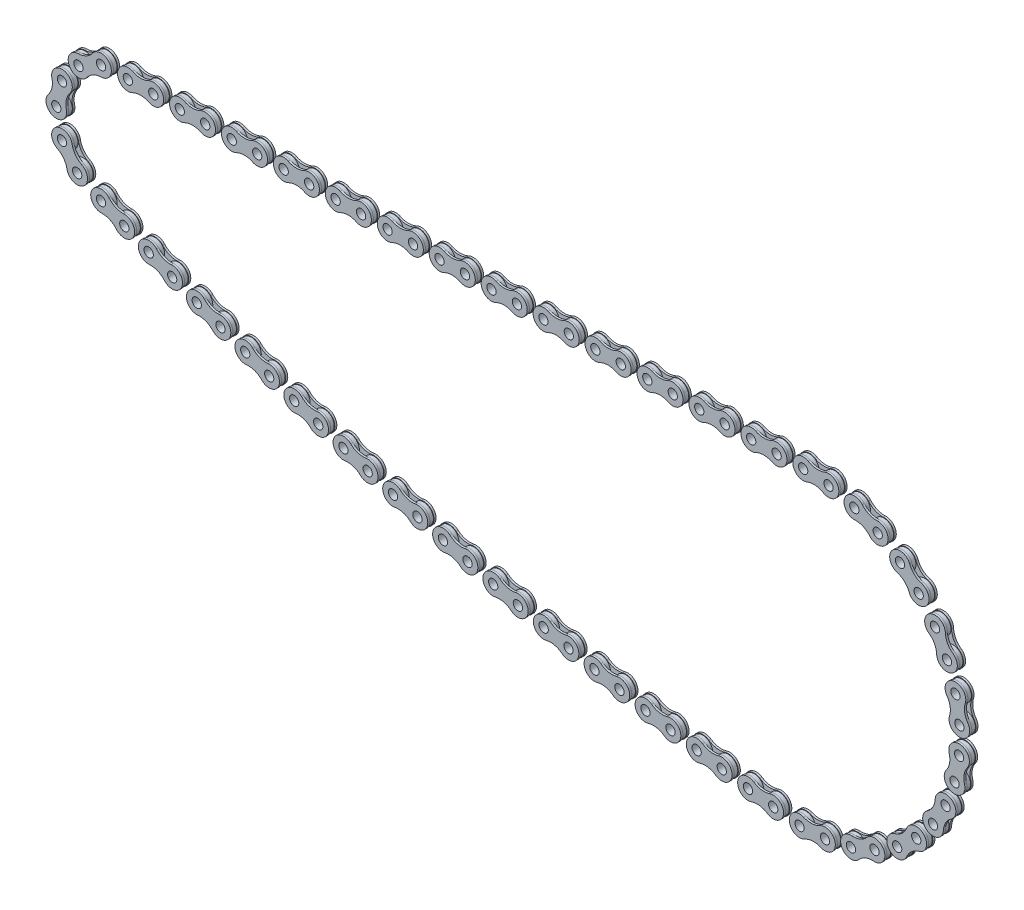
from build123d import *

# Parameters (mm, degrees)
SKETCH1_R             = 4.75
SKETCH1_R_2           = 2.25
BOSS_EXTRUDE1_DEPTH   = 1
BOSS_EXTRUDE1_2_DEPTH = 1
SKETCH2_R             = 2.25
BOSS_EXTRUDE5_DEPTH   = 1
CRVPATTERN3_5_ANGLE   = 4.2897485
CRVPATTERN3_6_ANGLE   = 23.4823476
CRVPATTERN3_7_ANGLE   = 42.6749468
CRVPATTERN3_8_ANGLE   = 61.8675459
CRVPATTERN3_9_ANGLE   = 81.0601451
CRVPATTERN3_10_ANGLE  = 100.2527442
CRVPATTERN3_11_ANGLE  = 119.4453434
CRVPATTERN3_12_ANGLE  = 138.6379425
CRVPATTERN3_13_ANGLE  = 157.8305417
CRVPATTERN3_14_ANGLE  = 177.0231408
CRVPATTERN3_15_ANGLE  = 172.4039679
CRVPATTERN3_16_ANGLE  = 171.1581482
CRVPATTERN3_17_ANGLE  = 169.9123286
CRVPATTERN3_18_ANGLE  = 168.6665089
CRVPATTERN3_19_ANGLE  = 167.4206893
CRVPATTERN3_20_ANGLE  = 166.1748696
CRVPATTERN3_21_ANGLE  = 164.92905
CRVPATTERN3_22_ANGLE  = 163.6832303
CRVPATTERN3_23_ANGLE  = 162.4374107
CRVPATTERN3_24_ANGLE  = 161.191591
CRVPATTERN3_25_ANGLE  = 159.9457714
CRVPATTERN3_26_ANGLE  = 158.6999517
CRVPATTERN3_27_ANGLE  = 157.4541321
CRVPATTERN3_28_ANGLE  = 156.2083125
CRVPATTERN3_29_ANGLE  = 126.7026711
CRVPATTERN3_30_ANGLE  = 77.2372093
CRVPATTERN3_31_ANGLE  = 27.7717476


with BuildPart() as part:
    # Sketch1 → Boss-Extrude1 (new, symmetric)
    with BuildSketch(Plane.XY):
        with Locations((-6.15, 0)):
            Circle(SKETCH1_R)
        with Locations((-6.15, 0)):
            Circle(SKETCH1_R_2, mode=Mode.SUBTRACT)
    extrude(amount=BOSS_EXTRUDE1_DEPTH, both=True)



with BuildPart() as body_2:
    # Sketch1 → Boss-Extrude1 2 (new, symmetric)
    with BuildSketch(Plane.XY):
        with Locations(Location((6.15, 0, 0), (0, 0, 180))):
            Circle(SKETCH1_R)
        with Locations((6.15, 0)):
            Circle(SKETCH1_R_2, mode=Mode.SUBTRACT)
    extrude(amount=BOSS_EXTRUDE1_2_DEPTH, both=True)


with BuildPart() as part_1:
    add(part.part)

    add(body_2.part)  # Boss-Extrude5 merges body 2
    # Sketch2 → Boss-Extrude5 (add)
    with BuildSketch(Plane.XY.offset(1)):
        with BuildLine():
            ThreePointArc((-3.930174121, -4.480220203), (0, -3.559956534), (3.930174121, -4.480220203))
            ThreePointArc((3.930174121, -4.480220203), (11.15, 0), (3.930174121, 4.480220203))
            ThreePointArc((3.930174121, 4.480220203), (0, 3.559956534), (-3.930174121, 4.480220203))
            ThreePointArc((-3.930174121, 4.480220203), (-11.15, 0), (-3.930174121, -4.480220203))
        make_face()
        with Locations((-6.15, 0)):
            Circle(SKETCH2_R, mode=Mode.SUBTRACT)
        with Locations((6.15, 0)):
            Circle(SKETCH2_R, mode=Mode.SUBTRACT)
    boss_extrude5 = extrude(amount=BOSS_EXTRUDE5_DEPTH)

    # Mirror2: Boss-Extrude5 across plane
    add(boss_extrude5.mirror(Plane.XY))


with BuildPart() as body_2_2:
    # CrvPattern3: read off the stored shape, not the designer's step
    # CrvPattern3: copy of part
    add(part_1.part.moved(Location((25.1230535, 0, 0))))


with BuildPart() as body_3:
    # CrvPattern3 2: copy of part
    add(part_1.part.moved(Location((50.2461071, 0, 0))))


with BuildPart() as body_4:
    # CrvPattern3 3: copy of part
    add(part_1.part.moved(Location((75.3691606, 0, 0))))


with BuildPart() as body_5:
    # CrvPattern3 4: copy of part
    add(part_1.part.moved(Location((100.4922141, 0, 0))))


with BuildPart() as body_6:
    # CrvPattern3 5: copy of part
    add(part_1.part.moved(Location((125.273847, 9.1861468, 0))).rotate(Axis((0, 0, 0), (0, 0, -1)), CRVPATTERN3_5_ANGLE))


with BuildPart() as body_7:
    # CrvPattern3 6: copy of part
    add(part_1.part.moved(Location((139.9469342, 54.0272652, 0))).rotate(Axis((0, 0, 0), (0, 0, -1)), CRVPATTERN3_6_ANGLE))


with BuildPart() as body_8:
    # CrvPattern3 7: copy of part
    add(part_1.part.moved(Location((139.0631961, 101.1997613, 0))).rotate(Axis((0, 0, 0), (0, 0, -1)), CRVPATTERN3_7_ANGLE))


with BuildPart() as body_9:
    # CrvPattern3 8: copy of part
    add(part_1.part.moved(Location((122.720871, 145.4598313, 0))).rotate(Axis((0, 0, 0), (0, 0, -1)), CRVPATTERN3_8_ANGLE))


with BuildPart() as body_10:
    # CrvPattern3 9: copy of part
    add(part_1.part.moved(Location((92.7366096, 181.8874232, 0))).rotate(Axis((0, 0, 0), (0, 0, -1)), CRVPATTERN3_9_ANGLE))


with BuildPart() as body_11:
    # CrvPattern3 10: copy of part
    add(part_1.part.moved(Location((52.4435318, 206.4331616, 0))).rotate(Axis((0, 0, 0), (0, 0, -1)), CRVPATTERN3_10_ANGLE))


with BuildPart() as body_12:
    # CrvPattern3 11: copy of part
    add(part_1.part.moved(Location((6.3207096, 216.3684853, 0))).rotate(Axis((0, 0, 0), (0, 0, -1)), CRVPATTERN3_11_ANGLE))


with BuildPart() as body_13:
    # CrvPattern3 12: copy of part
    add(part_1.part.moved(Location((-40.5047373, 210.5889607, 0))).rotate(Axis((0, 0, 0), (0, 0, -1)), CRVPATTERN3_12_ANGLE))


with BuildPart() as body_14:
    # CrvPattern3 13: copy of part
    add(part_1.part.moved(Location((-82.8275838, 189.7370531, 0))).rotate(Axis((0, 0, 0), (0, 0, -1)), CRVPATTERN3_13_ANGLE))


with BuildPart() as body_15:
    # CrvPattern3 14: copy of part
    add(part_1.part.moved(Location((-115.9431242, 156.130709, 0))).rotate(Axis((0, 0, 0), (0, 0, -1)), CRVPATTERN3_14_ANGLE))


with BuildPart() as body_16:
    # CrvPattern3 15: copy of part
    add(part_1.part.moved(Location((-117.5780786, 133.5382391, 0))).rotate(Axis((0, 0, 0), (0, 0, 1)), CRVPATTERN3_15_ANGLE))


with BuildPart() as body_17:
    # CrvPattern3 16: copy of part
    add(part_1.part.moved(Location((-95.3325916, 131.2234198, 0))).rotate(Axis((0, 0, 0), (0, 0, 1)), CRVPATTERN3_16_ANGLE))


with BuildPart() as body_18:
    # CrvPattern3 17: copy of part
    add(part_1.part.moved(Location((-73.0420345, 129.3928078, 0))).rotate(Axis((0, 0, 0), (0, 0, 1)), CRVPATTERN3_17_ANGLE))


with BuildPart() as body_19:
    # CrvPattern3 18: copy of part
    add(part_1.part.moved(Location((-50.7169454, 128.0472686, 0))).rotate(Axis((0, 0, 0), (0, 0, 1)), CRVPATTERN3_18_ANGLE))


with BuildPart() as body_20:
    # CrvPattern3 19: copy of part
    add(part_1.part.moved(Location((-28.367879, 127.1874381, 0))).rotate(Axis((0, 0, 0), (0, 0, 1)), CRVPATTERN3_19_ANGLE))


with BuildPart() as body_21:
    # CrvPattern3 20: copy of part
    add(part_1.part.moved(Location((-6.0054012, 126.813723, 0))).rotate(Axis((0, 0, 0), (0, 0, 1)), CRVPATTERN3_20_ANGLE))


with BuildPart() as body_22:
    # CrvPattern3 21: copy of part
    add(part_1.part.moved(Location((16.3599158, 126.9263, 0))).rotate(Axis((0, 0, 0), (0, 0, 1)), CRVPATTERN3_21_ANGLE))


with BuildPart() as body_23:
    # CrvPattern3 22: copy of part
    add(part_1.part.moved(Location((38.7174983, 127.5251157, 0))).rotate(Axis((0, 0, 0), (0, 0, 1)), CRVPATTERN3_22_ANGLE))


with BuildPart() as body_24:
    # CrvPattern3 23: copy of part
    add(part_1.part.moved(Location((61.0567764, 128.6098871, 0))).rotate(Axis((0, 0, 0), (0, 0, 1)), CRVPATTERN3_23_ANGLE))


with BuildPart() as body_25:
    # CrvPattern3 24: copy of part
    add(part_1.part.moved(Location((83.3671889, 130.1801014, 0))).rotate(Axis((0, 0, 0), (0, 0, 1)), CRVPATTERN3_24_ANGLE))


with BuildPart() as body_26:
    # CrvPattern3 25: copy of part
    add(part_1.part.moved(Location((105.638188, 132.2350162, 0))).rotate(Axis((0, 0, 0), (0, 0, 1)), CRVPATTERN3_25_ANGLE))


with BuildPart() as body_27:
    # CrvPattern3 26: copy of part
    add(part_1.part.moved(Location((127.8592448, 134.77366, 0))).rotate(Axis((0, 0, 0), (0, 0, 1)), CRVPATTERN3_26_ANGLE))


with BuildPart() as body_28:
    # CrvPattern3 27: copy of part
    add(part_1.part.moved(Location((150.0198539, 137.7948326, 0))).rotate(Axis((0, 0, 0), (0, 0, 1)), CRVPATTERN3_27_ANGLE))


with BuildPart() as body_29:
    # CrvPattern3 28: copy of part
    add(part_1.part.moved(Location((172.1095384, 141.2971057, 0))).rotate(Axis((0, 0, 0), (0, 0, 1)), CRVPATTERN3_28_ANGLE))


with BuildPart() as body_30:
    # CrvPattern3 29: copy of part
    add(part_1.part.moved(Location((103.3750687, 216.4644868, 0))).rotate(Axis((0, 0, 0), (0, 0, 1)), CRVPATTERN3_29_ANGLE))


with BuildPart() as body_31:
    # CrvPattern3 30: copy of part
    add(part_1.part.moved(Location((-75.2155867, 229.435896, 0))).rotate(Axis((0, 0, 0), (0, 0, 1)), CRVPATTERN3_30_ANGLE))


with BuildPart() as body_32:
    # CrvPattern3 31: copy of part
    add(part_1.part.moved(Location((-201.1412372, 102.1346384, 0))).rotate(Axis((0, 0, 0), (0, 0, 1)), CRVPATTERN3_31_ANGLE))


with BuildPart() as body_33:
    # CrvPattern3 32: copy of part
    add(part_1.part.moved(Location((-200.9844282, 0, 0))))


with BuildPart() as body_34:
    # CrvPattern3 33: copy of part
    add(part_1.part.moved(Location((-175.8613747, 0, 0))))


with BuildPart() as body_35:
    # CrvPattern3 34: copy of part
    add(part_1.part.moved(Location((-150.7383212, 0, 0))))


with BuildPart() as body_36:
    # CrvPattern3 35: copy of part
    add(part_1.part.moved(Location((-125.6152677, 0, 0))))


with BuildPart() as body_37:
    # CrvPattern3 36: copy of part
    add(part_1.part.moved(Location((-100.4922141, 0, 0))))


with BuildPart() as body_38:
    # CrvPattern3 37: copy of part
    add(part_1.part.moved(Location((-75.3691606, 0, 0))))


with BuildPart() as body_39:
    # CrvPattern3 38: copy of part
    add(part_1.part.moved(Location((-50.2461071, 0, 0))))


with BuildPart() as body_40:
    # CrvPattern3 39: copy of part
    add(part_1.part.moved(Location((-25.1230535, 0, 0))))


solid = Compound([part_1.part, body_2_2.part, body_3.part, body_4.part, body_5.part, body_6.part, body_7.part, body_8.part, body_9.part, body_10.part, body_11.part, body_12.part, body_13.part, body_14.part, body_15.part, body_16.part, body_17.part, body_18.part, body_19.part, body_20.part, body_21.part, body_22.part, body_23.part, body_24.part, body_25.part, body_26.part, body_27.part, body_28.part, body_29.part, body_30.part, body_31.part, body_32.part, body_33.part, body_34.part, body_35.part, body_36.part, body_37.part, body_38.part, body_39.part, body_40.part])
